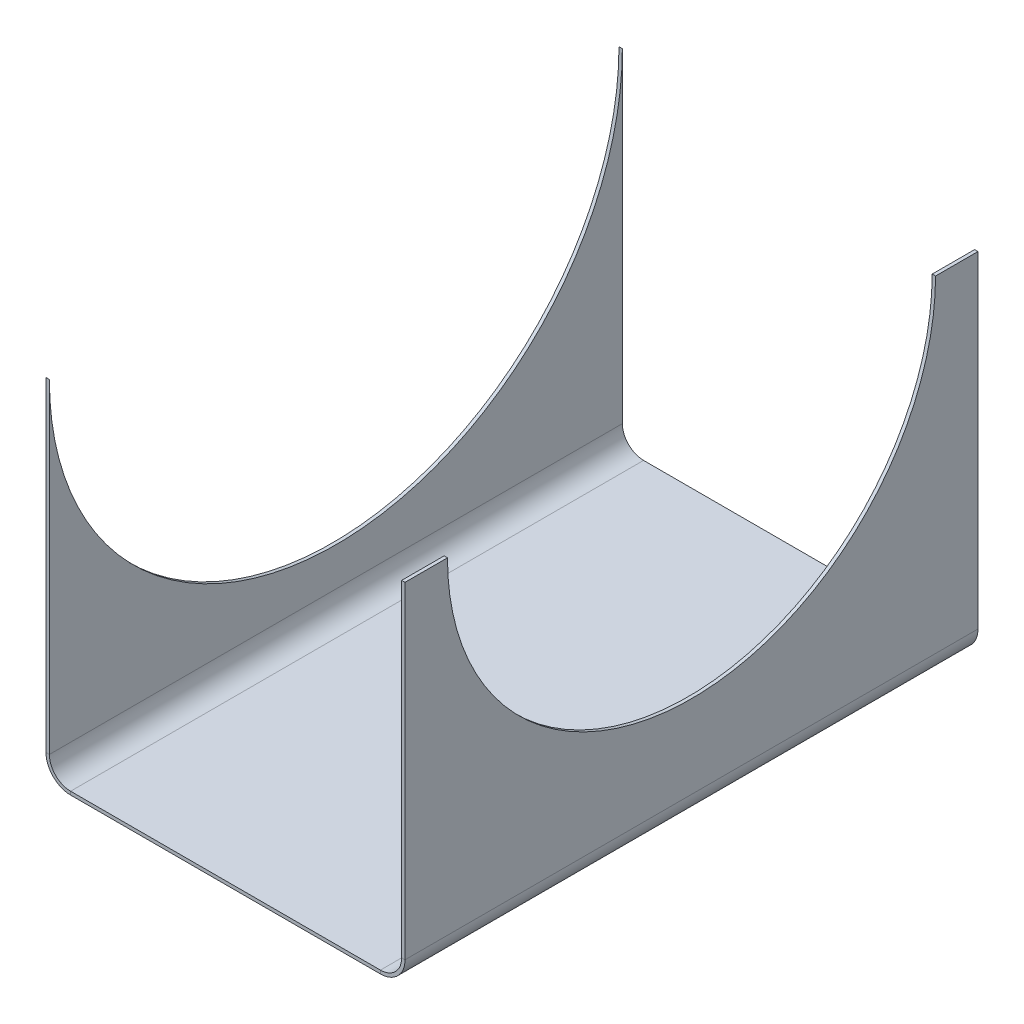
from build123d import *

# Parameters (mm, degrees)
SKETCH1_W                  = 487
SKETCH1_H                  = 270
BOSS_EXTRUDE1_DEPTH        = 1.5875
SKETCH2_R                  = 135
SKETCH2_R_2                = 115
CUT_EXTRUDE1_DEPTH         = 557.840659575
SKETCHED_BEND2_DEPTH       = 270
SKETCHED_BEND2_2_DEPTH     = 270
SKETCHED_START             = -1
SKETCHED_BEND2_3_OUTLINE_W = 1.5875
SKETCHED_BEND2_3_OUTLINE_H = 270
SKETCHED_BEND2_3_DEPTH     = 161
SKETCHED_START_2           = 326
SKETCHED_BEND2_4_DEPTH     = 1.5875
SKETCHED_START_3           = 158.4125
SKETCHED_BEND2_5_DEPTH     = 11.5875
SKETCHED_BEND2_6_DEPTH     = 270


with BuildPart() as part:
    # Sketch1 → Boss-Extrude1 (new body)
    with BuildSketch(Plane(origin=(0, 0, 0), x_dir=(1, 0, 0), z_dir=(0, 1, 0))):
        with Locations((243.5, -135)):
            Rectangle(SKETCH1_W, SKETCH1_H)
    extrude(amount=BOSS_EXTRUDE1_DEPTH)

    # Sketch2 → Cut-Extrude1 (cut, through all)
    with BuildSketch(Plane(origin=(0, 1.5875, 0), x_dir=(1, 0, 0), z_dir=(0, 1, 0))):
        with Locations((0, -135)):
            Circle(SKETCH2_R)
        with Locations((487, -135)):
            Circle(SKETCH2_R_2)
    extrude(amount=-CUT_EXTRUDE1_DEPTH, mode=Mode.SUBTRACT)

    # Sketched Bend2: read off the stored shape, not the designer's step
    # Sketched Bend2 outline → Sketched Bend2 (cut)
    with BuildSketch(Plane.XY):
        with BuildLine():
            ThreePointArc((321.854071767, 1.5875), (319.032750917, 0.403914791), (316, 0))
            Line((316, 0), (487, 0))
            Line((487, 0), (487, 1.5875))
            Line((487, 1.5875), (321.854071767, 1.5875))
        make_face()
    extrude(amount=SKETCHED_BEND2_DEPTH, mode=Mode.SUBTRACT)

    # Sketched Bend2 2 outline → Sketched Bend2 2 (add)
    with BuildSketch(Plane.XY):
        with BuildLine():
            ThreePointArc((326, 11.5875), (323.071067812, 4.516432188), (316, 1.5875))
            Line((316, 1.5875), (321.854071767, 1.5875))
            ThreePointArc((321.854071767, 1.5875), (326.052467678, 5.8239898), (327.5875, 11.5875))
            Line((327.5875, 11.5875), (327.5875, 165.632717148))
            Line((327.5875, 165.632717148), (326, 165.632717148))
            Line((326, 165.632717148), (326, 11.5875))
        make_face()
    extrude(amount=SKETCHED_BEND2_2_DEPTH)

    # Sketched Bend2 3 outline → Sketched Bend2 3 (cut)
    with BuildSketch(Plane.YZ.offset(SKETCHED_START)):
        with Locations((0.79375, 135)):
            Rectangle(SKETCHED_BEND2_3_OUTLINE_W, SKETCHED_BEND2_3_OUTLINE_H)
    extrude(amount=SKETCHED_BEND2_3_DEPTH, mode=Mode.SUBTRACT)

    # Sketched Bend2 4 outline → Sketched Bend2 4 (cut)
    with BuildSketch(Plane.YZ.offset(SKETCHED_START_2)):
        with BuildLine():
            ThreePointArc((165.632717148, 250), (50.632717148, 135), (165.632717148, 20))
            Line((165.632717148, 20), (165.632717148, 250))
        make_face()
    extrude(amount=SKETCHED_BEND2_4_DEPTH, mode=Mode.SUBTRACT)

    # Sketched Bend2 5 outline → Sketched Bend2 5 (add)
    with BuildSketch(Plane.YZ.offset(SKETCHED_START_3)):
        with BuildLine():
            Line((164.632717148, 270), (1.5875, 270))
            Line((1.5875, 270), (1.5875, 0))
            Line((1.5875, 0), (164.632717148, 0))
            ThreePointArc((164.632717148, 0), (29.632717148, 135), (164.632717148, 270))
        make_face()
    extrude(amount=SKETCHED_BEND2_5_DEPTH)

    # Sketched Bend2 6 outline → Sketched Bend2 6 (cut)
    with BuildSketch(Plane.XY):
        with BuildLine():
            Line((160, 167), (160, 11.5875))
            ThreePointArc((160, 11.5875), (162.928932188, 4.516432188), (170, 1.5875))
            Line((170, 1.5875), (170, 167))
            Line((170, 167), (160, 167))
        make_face()
        with BuildLine():
            Line((329, -2), (329, 0))
            Line((329, 0), (170, 0))
            ThreePointArc((170, 0), (161.806400173, 3.393900173), (158.4125, 11.5875))
            Line((158.4125, 11.5875), (158.4125, 1.5875))
            Line((158.4125, 1.5875), (160, 1.5875))
            Line((160, 1.5875), (160, -2))
            Line((160, -2), (329, -2))
        make_face()
    extrude(amount=SKETCHED_BEND2_6_DEPTH, mode=Mode.SUBTRACT)


solid = part.part
